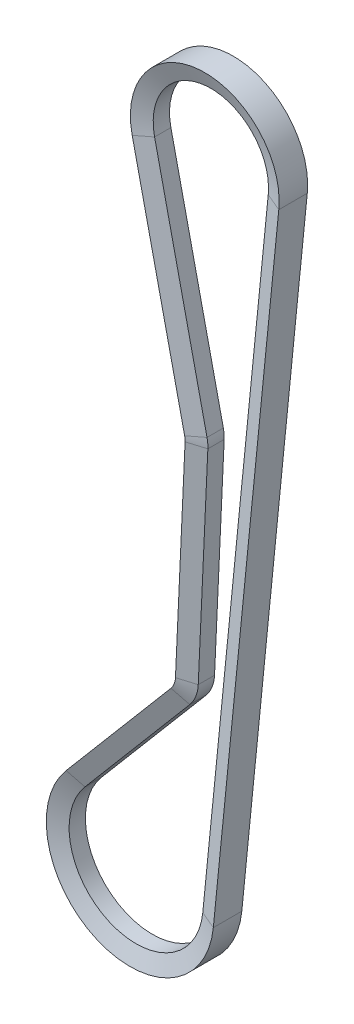
from build123d import *


with BuildPart() as part:
    # Sweep1: sweep along a path in Sketch2
    with BuildLine(Plane.XY) as sweep1_path:
        Line((24.751480307, -2.475853245), (2.856695994, -221.361331966))
        ThreePointArc((2.856695994, -221.361331966), (-35.944231546, -244.34879289), (-46.363550615, -200.469718973))
        Line((-46.363550615, -200.469718973), (-11.308829358, -159.113452621))
        ThreePointArc((-11.308829358, -159.113452621), (-10.24311703, -157.330926461), (-9.809541742, -155.299878766))
        Line((-9.809541742, -155.299878766), (-6.587131285, -85.374089025))
        ThreePointArc((-6.587131285, -85.374089025), (-6.60453572, -84.528643538), (-6.734123299, -83.693007225))
        Line((-6.734123299, -83.693007225), (-24.272813713, -5.440233556))
        ThreePointArc((-24.272813713, -5.440233556), (-1.501388719, 24.829648781), (24.751480307, -2.475853245))
    # Sketch3 → Sweep1 (sweep)
    with BuildSketch(Plane(origin=(-24.272813713, -5.440233556, 0), x_dir=(0.9757915047161444, 0.21870285623146954, 0), z_dir=(-0.21870285623146954, 0.9757915047161444, 0))):
        Polygon((0, -4.7625), (0, 4.7625), (5.588, 2.728634331), (5.588, -2.728634331), align=None)
    sweep(path=sweep1_path.line)


solid = part.part
